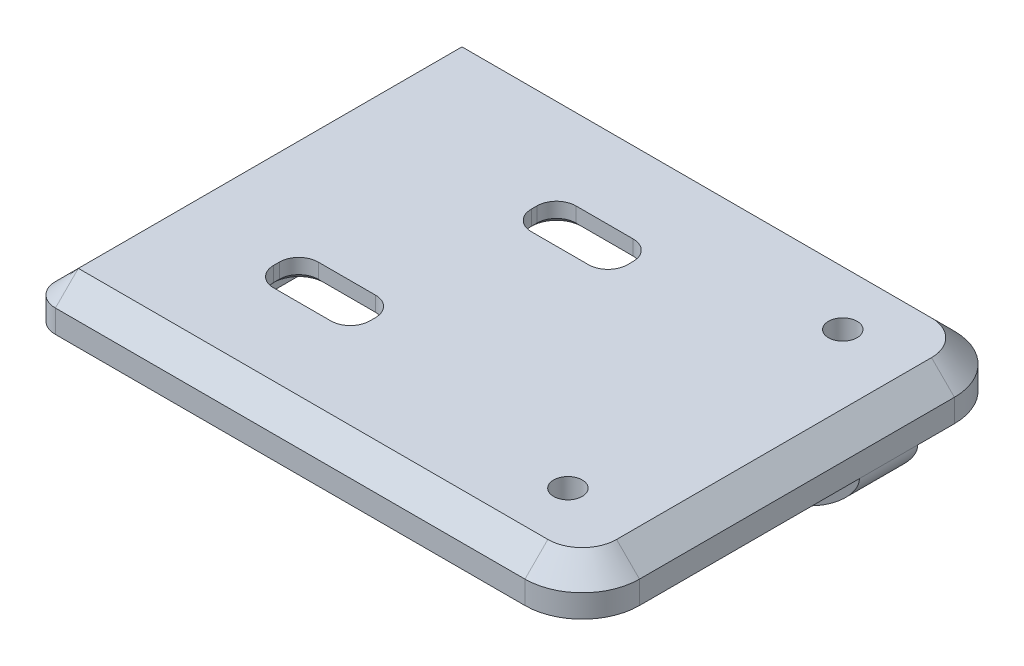
from build123d import *

# Parameters (mm, degrees)
BOSS_EXTRUDE1_START     = -0.8
BOSS_EXTRUDE1_OUTLINE_W = 48
BOSS_EXTRUDE1_OUTLINE_H = 37.5
BOSS_EXTRUDE1_DEPTH     = 0.8
BOSS_EXTRUDE2_DEPTH     = 4
SKETCH6_R               = 1.25
CUT_EXTRUDE3_DEPTH      = 36.602843988
BOSS_EXTRUDE3_DEPTH     = 2
SKETCH8_W               = 1.2
SKETCH8_H               = 13
BOSS_EXTRUDE4_DEPTH     = 6
SKETCH9_W               = 13
SKETCH9_H               = 0.8
BOSS_EXTRUDE5_DEPTH     = 1
FILLET3_R               = 5
FILLET2_R               = 1
FILLET6_R               = 2
CHAMFER1_SIZE           = 2
FILLET5_R               = 2
BOSS_EXTRUDE6_START     = 2
SKETCH11_R              = 3.1
SKETCH11_R_2            = 1.25
BOSS_EXTRUDE6_DEPTH     = 2
CHAMFER3_SIZE           = 0.4
CHAMFER4_SIZE           = 1
BOSS_EXTRUDE7_START     = 1
BOSS_EXTRUDE7_DEPTH     = 1
CHAMFER5_SIZE           = 1
CHAMFER6_SIZE           = 0.5
FILLET7_R               = 2


# Read off the part's stored shape, not the designer's step: Boss-Extrude1
# Some blends are built 0.0001 mm under size
with BuildPart() as part:
    # Boss-Extrude1 outline → Boss-Extrude1 (new body)
    with BuildSketch(Plane(origin=(0, 0, 0), x_dir=(1, 0, 0), z_dir=(0, 1, 0)).offset(BOSS_EXTRUDE1_START)):
        with Locations((6, 0)):
            Rectangle(BOSS_EXTRUDE1_OUTLINE_W, BOSS_EXTRUDE1_OUTLINE_H)
    extrude(amount=BOSS_EXTRUDE1_DEPTH)

    # Sketch3 → Boss-Extrude2 (add)
    with BuildSketch(Plane(origin=(0, 0, 0), x_dir=(1, 0, 0), z_dir=(0, 1, 0))):
        Polygon((-18, 18.75), (17, 18.75), (30, 18.75), (30, -18.75), (-18, -18.75), align=None)
        Polygon((-15.25, -16.75), (15.25, -16.75), (15.25, -10.876016447), (19.25, -6.645247216), (19.25, -0.095137399), (15.25, -4.32590663), (15.25, 16.75), (-15.25, 16.75), align=None, mode=Mode.SUBTRACT)
    extrude(amount=-BOSS_EXTRUDE2_DEPTH)

    # Sketch6 → Cut-Extrude3 (cut, through all)
    with BuildSketch(Plane(origin=(0, -4, 0), x_dir=(-1, 0, 0), z_dir=(0, -1, 0))):
        with Locations(Location((-22, 12, 0), (0, 0, 90))):
            Circle(SKETCH6_R)
        with Locations(Location((-22, -12, 0), (0, 0, 90))):
            Circle(SKETCH6_R)
        with BuildLine():
            Line((0.7, 7.5), (0.7, 8))
            ThreePointArc((0.7, 8), (0.202081528, 9.202081528), (-1, 9.7))
            Line((-1, 9.7), (-6, 9.7))
            ThreePointArc((-6, 9.7), (-7.202081528, 9.202081528), (-7.7, 8))
            Line((-7.7, 8), (-7.7, 7.5))
            ThreePointArc((-7.7, 7.5), (-7.202081528, 6.297918472), (-6, 5.8))
            Line((-6, 5.8), (-1, 5.8))
            ThreePointArc((-1, 5.8), (0.202081528, 6.297918472), (0.7, 7.5))
        make_face()
        with BuildLine():
            Line((1, -9.7), (6, -9.7))
            ThreePointArc((6, -9.7), (7.202081528, -9.202081528), (7.7, -8))
            Line((7.7, -8), (7.7, -7.5))
            ThreePointArc((7.7, -7.5), (7.202081528, -6.297918472), (6, -5.8))
            Line((6, -5.8), (1, -5.8))
            ThreePointArc((1, -5.8), (-0.202081528, -6.297918472), (-0.7, -7.5))
            Line((-0.7, -7.5), (-0.7, -8))
            ThreePointArc((-0.7, -8), (-0.202081528, -9.202081528), (1, -9.7))
        make_face()
    extrude(amount=-CUT_EXTRUDE3_DEPTH, mode=Mode.SUBTRACT)

    # Sketch7 → Boss-Extrude3 (add)
    with BuildSketch(Plane.XZ.offset(4)):
        Polygon((19.25, 5.917457236), (30, -5.452735071), (30, -10.547264929), (19.25, 0.822927379), align=None)
    extrude(amount=BOSS_EXTRUDE3_DEPTH)

    # Sketch8 → Boss-Extrude4 (add)
    with BuildSketch(Plane.XZ.offset(4)):
        with Locations((-17.4, 0)):
            Rectangle(SKETCH8_W, SKETCH8_H)
    extrude(amount=BOSS_EXTRUDE4_DEPTH)

    # Sketch9 → Boss-Extrude5 (add)
    with BuildSketch(Plane(origin=(-16.8, 0, 0), x_dir=(0, 0, -1), z_dir=(1, 0, 0))):
        with Locations((0, -9.6)):
            Rectangle(SKETCH9_W, SKETCH9_H)
    extrude(amount=BOSS_EXTRUDE5_DEPTH)

    # Fillet3
    fillet3_edges = [part.edges().sort_by_distance(p)[0] for p in [
        (30, -2, -18.75),
        (30, -2, 18.75),
        (15.25, -2.4, -16.75),
        (-15.25, -2.4, -16.75),
        (15.25, -2.4, 16.75),
        (-15.25, -2.4, 16.75),
        (-17.4, -4, 6.5),
        (-17.4, -4, -6.5),
    ]]
    fillet(fillet3_edges, radius=FILLET3_R)

    # Fillet2
    fillet2_edges = [part.edges().sort_by_distance(p)[0] for p in [
        (-16.8, -4, 0),
    ]]
    fillet(fillet2_edges, radius=FILLET2_R)

    # Fillet6
    fillet6_edges = [part.edges().sort_by_distance(p)[0] for p in [
        (15.25, -2.4, 4.32590663),
        (15.25, -2.4, 10.876016447),
        (-18, -2, -18.75),
        (-18, -2, 18.75),
    ]]
    fillet(fillet6_edges, radius=FILLET6_R)

    # Chamfer1
    # the kernel refuses this chamfer: 2 mm, written as the material it adds along each edge
    with BuildSketch(Plane(origin=(10.25, -0.8, -16.75), x_dir=(0, -0.9996219169112968, -0.027495876610585633), z_dir=(-1, 0, 0)), Plane(origin=(-10.25, -0.8, 16.75), x_dir=(0, -0.9996219169112968, 0.027495876610585633), z_dir=(1, 0, 0))) as chamfer1_piece_1:
        with BuildLine():
            Line((2.05734639, 0), (-0.11309431, 2.054235587))
            Line((-0.11309431, 2.054235587), (-0.153079186, 2.053135752))
            ThreePointArc((-0.153079186, 2.053135752), (-0.068258454, 1.026795659), (-0.039984877, -0.001099835))
            Line((-0.039984877, -0.001099835), (0.001099835, -0.039984877))
            ThreePointArc((0.001099835, -0.039984877), (1.028995329, -0.011711299), (2.058446225, -0.039984877))
            Line((2.058446225, -0.039984877), (2.05734639, 0))
        make_face()
    extrude(amount=20.5)
    with BuildSketch(Plane(origin=(15.25, -0.8, 11.75), x_dir=(0.027495876610586497, -0.9996219169112968, 0), z_dir=(0, 0, -1))) as chamfer1_piece_2:
        with BuildLine():
            Line((2.05734639, 0), (-0.11309431, 2.054235587))
            Line((-0.11309431, 2.054235587), (-0.153079186, 2.053135752))
            ThreePointArc((-0.153079186, 2.053135752), (-0.068258454, 1.026795659), (-0.039984877, -0.001099835))
            Line((-0.039984877, -0.001099835), (0.001099835, -0.039984877))
            ThreePointArc((0.001099835, -0.039984877), (1.028995329, -0.011711299), (2.058446225, -0.039984877))
            Line((2.058446225, -0.039984877), (2.05734639, 0))
        make_face()
    extrude(amount=0.07820825)
    with BuildSketch(Plane(origin=(-15.25, -0.8, -11.75), x_dir=(-0.02749587661058736, -0.9996219169112968, 0), z_dir=(0, 0, 1))) as chamfer1_piece_3:
        with BuildLine():
            Line((2.05734639, 0), (-0.11309431, 2.054235587))
            Line((-0.11309431, 2.054235587), (-0.153079186, 2.053135752))
            ThreePointArc((-0.153079186, 2.053135752), (-0.068258454, 1.026795659), (-0.039984877, -0.001099835))
            Line((-0.039984877, -0.001099835), (0.001099835, -0.039984877))
            ThreePointArc((0.001099835, -0.039984877), (1.028995329, -0.011711299), (2.058446225, -0.039984877))
            Line((2.058446225, -0.039984877), (2.05734639, 0))
        make_face()
    extrude(amount=23.5)
    with BuildSketch(Plane(origin=(-10.25, -0.8, 11.75), x_dir=(-1, 0, 0), z_dir=(0, 0, -1))) as chamfer1_piece_4:
        with BuildLine():
            Line((5.056568542, -2.056568542), (2.943431458, 0.056568542))
            Line((2.943431458, 0.056568542), (2.943431458, 0.096568542))
            ThreePointArc((2.943431458, 0.096568542), (3.971715729, 0.04), (5, 0.04))
            Line((5, 0.04), (5.04, 0))
            ThreePointArc((5.04, 0), (5.04, -1.028284271), (5.096568542, -2.056568542))
            Line((5.096568542, -2.056568542), (5.056568542, -2.056568542))
        make_face()
    revolve(axis=Axis((-10.25, -0.8, 11.75), (0, 1, 0)), revolution_arc=90)
    with BuildSketch(Plane(origin=(10.25, -0.8, 11.75), x_dir=(0, 0, 1), z_dir=(-1, 0, 0))) as chamfer1_piece_5:
        with BuildLine():
            Line((5.056568542, -2.056568542), (2.943431458, 0.056568542))
            Line((2.943431458, 0.056568542), (2.943431458, 0.096568542))
            ThreePointArc((2.943431458, 0.096568542), (3.971715729, 0.04), (5, 0.04))
            Line((5, 0.04), (5.04, 0))
            ThreePointArc((5.04, 0), (5.04, -1.028284271), (5.096568542, -2.056568542))
            Line((5.096568542, -2.056568542), (5.056568542, -2.056568542))
        make_face()
    revolve(axis=Axis((10.25, -0.8, 11.75), (0, 1, 0)), revolution_arc=90)
    with BuildSketch(Plane(origin=(-10.25, -0.8, -11.75), x_dir=(0, 0, -1), z_dir=(1, 0, 0))) as chamfer1_piece_6:
        with BuildLine():
            Line((5.056568542, -2.056568542), (2.943431458, 0.056568542))
            Line((2.943431458, 0.056568542), (2.943431458, 0.096568542))
            ThreePointArc((2.943431458, 0.096568542), (3.971715729, 0.04), (5, 0.04))
            Line((5, 0.04), (5.04, 0))
            ThreePointArc((5.04, 0), (5.04, -1.028284271), (5.096568542, -2.056568542))
            Line((5.096568542, -2.056568542), (5.056568542, -2.056568542))
        make_face()
    revolve(axis=Axis((-10.25, -0.8, -11.75), (0, 1, 0)), revolution_arc=90)
    with BuildSketch(Plane(origin=(10.25, -0.8, -11.75), x_dir=(1, 0, 0), z_dir=(0, 0, 1))) as chamfer1_piece_7:
        with BuildLine():
            Line((5.056568542, -2.056568542), (2.943431458, 0.056568542))
            Line((2.943431458, 0.056568542), (2.943431458, 0.096568542))
            ThreePointArc((2.943431458, 0.096568542), (3.971715729, 0.04), (5, 0.04))
            Line((5, 0.04), (5.04, 0))
            ThreePointArc((5.04, 0), (5.04, -1.028284271), (5.096568542, -2.056568542))
            Line((5.096568542, -2.056568542), (5.056568542, -2.056568542))
        make_face()
    revolve(axis=Axis((10.25, -0.8, -11.75), (0, 1, 0)), revolution_arc=90)
    with BuildSketch(Plane(origin=(15.796706691, -0.8, 10.297768985), x_dir=(0.01997978675069661, -0.9996219169112968, 0.018889980200658588), z_dir=(0.6870113824043602, 0, -0.7266466544661511))) as chamfer1_piece_8:
        with BuildLine():
            Line((2.05734639, 0), (-0.11309431, 2.054235587))
            Line((-0.11309431, 2.054235587), (-0.153079186, 2.053135752))
            ThreePointArc((-0.153079186, 2.053135752), (-0.068258454, 1.026795659), (-0.039984877, -0.001099835))
            Line((-0.039984877, -0.001099835), (0.001099835, -0.039984877))
            ThreePointArc((0.001099835, -0.039984877), (1.028995329, -0.011711299), (2.058446225, -0.039984877))
            Line((2.058446225, -0.039984877), (2.05734639, 0))
        make_face()
    extrude(amount=10.16991051)
    with BuildSketch(Plane(origin=(22.783550969, -0.8, -3.64227228), x_dir=(-0.019979786750696504, -0.9996219169112968, -0.018889980200658484), z_dir=(-0.6870113824043601, 0, 0.7266466544661513))) as chamfer1_piece_9:
        with BuildLine():
            Line((2.05734639, 0), (-0.11309431, 2.054235587))
            Line((-0.11309431, 2.054235587), (-0.153079186, 2.053135752))
            ThreePointArc((-0.153079186, 2.053135752), (-0.068258454, 1.026795659), (-0.039984877, -0.001099835))
            Line((-0.039984877, -0.001099835), (0.001099835, -0.039984877))
            ThreePointArc((0.001099835, -0.039984877), (1.028995329, -0.011711299), (2.058446225, -0.039984877))
            Line((2.058446225, -0.039984877), (2.05734639, 0))
        make_face()
    extrude(amount=5.939141279)
    with BuildSketch(Plane(origin=(15.25, -0.8, -0.700637904), x_dir=(0.027495876610585623, -0.9996219169112968, 0), z_dir=(0, 0, -1))) as chamfer1_piece_10:
        with BuildLine():
            Line((2.05734639, 0), (-0.11309431, 2.054235587))
            Line((-0.11309431, 2.054235587), (-0.153079186, 2.053135752))
            ThreePointArc((-0.153079186, 2.053135752), (-0.068258454, 1.026795659), (-0.039984877, -0.001099835))
            Line((-0.039984877, -0.001099835), (0.001099835, -0.039984877))
            ThreePointArc((0.001099835, -0.039984877), (1.028995329, -0.011711299), (2.058446225, -0.039984877))
            Line((2.058446225, -0.039984877), (2.05734639, 0))
        make_face()
    extrude(amount=11.049362096)
    with BuildSketch(Plane(origin=(17.25, -0.8, 11.67179175), x_dir=(-0.7266466544661513, 0, -0.6870113824043599), z_dir=(0.6870113824043599, 0, -0.7266466544661513))) as chamfer1_piece_11:
        with BuildLine():
            Line((1.943431458, -2.056568542), (4.056568542, 0.056568542))
            Line((4.056568542, 0.056568542), (4.056568542, 0.096568542))
            ThreePointArc((4.056568542, 0.096568542), (3.028284271, 0.04), (2, 0.04))
            Line((2, 0.04), (1.96, 0))
            ThreePointArc((1.96, 0), (1.96, -1.028284271), (1.903431458, -2.056568542))
            Line((1.903431458, -2.056568542), (1.943431458, -2.056568542))
        make_face()
    revolve(axis=Axis((17.25, -0.8, 11.67179175), (0, 1, 0)), revolution_arc=43.393997011)
    with BuildSketch(Plane(origin=(17.25, -0.8, -0.700637904), x_dir=(-1, 0, 0), z_dir=(0, 0, -1))) as chamfer1_piece_12:
        with BuildLine():
            Line((1.943431458, -2.056568542), (4.056568542, 0.056568542))
            Line((4.056568542, 0.056568542), (4.056568542, 0.096568542))
            ThreePointArc((4.056568542, 0.096568542), (3.028284271, 0.04), (2, 0.04))
            Line((2, 0.04), (1.96, 0))
            ThreePointArc((1.96, 0), (1.96, -1.028284271), (1.903431458, -2.056568542))
            Line((1.903431458, -2.056568542), (1.943431458, -2.056568542))
        make_face()
    revolve(axis=Axis((17.25, -0.8, -0.700637904), (0, 1, 0)), revolution_arc=136.606002989)
    chamfer1_2_edges = [part.edges().sort_by_distance(p)[0] for p in [
        (30, 0, 0),
        (4.5, 0, -18.75),
        (28.535533906, 0, 17.285533906),
        (28.535533906, 0, -17.285533906),
        (-18, 0, 0),
        (4.5, 0, 18.75),
        (-17.414213562, 0, -18.164213562),
        (-17.414213562, 0, 18.164213562),
    ]]
    chamfer(chamfer1_2_edges, length=CHAMFER1_SIZE)

    # Fillet5
    fillet5_edges = [part.edges().sort_by_distance(p)[0] for p in [
        (19.25, -0.8, 3.248775504),
    ]]
    fillet(fillet5_edges, radius=FILLET5_R)

    # Sketch11 → Boss-Extrude6 (add)
    # profile 1 of 2: a face of its own
    with BuildSketch(Plane.XZ.offset(4).offset(BOSS_EXTRUDE6_START)):
        with Locations(Location((22, -12, 0), (0, 0, 90))):
            Circle(SKETCH11_R)
        with Locations(Location((22, -12, 0), (0, 0, 270))):
            Circle(SKETCH11_R_2, mode=Mode.SUBTRACT)
    # profile 2 of 2: a face of its own
    with BuildSketch(Plane.XZ.offset(4).offset(BOSS_EXTRUDE6_START)):
        with Locations(Location((22, 12, 0), (0, 0, 90))):
            Circle(SKETCH11_R)
        with Locations(Location((22, 12, 0), (0, 0, 270))):
            Circle(SKETCH11_R_2, mode=Mode.SUBTRACT)
    extrude(amount=-BOSS_EXTRUDE6_DEPTH)

    # Chamfer3
    chamfer3_edges = [part.edges().sort_by_distance(p)[0] for p in [
        (22, -4, -15.1),
        (22, -6, -15.1),
        (22, -4, 8.9),
        (22, -6, 8.9),
    ]]
    chamfer(chamfer3_edges, length=CHAMFER3_SIZE)

    # Chamfer4
    chamfer4_edges = [part.edges().sort_by_distance(p)[0] for p in [
        (22, -6, -10.75),
        (22, -6, 13.25),
    ]]
    chamfer(chamfer4_edges, length=CHAMFER4_SIZE)

    # Sketch12 → Boss-Extrude7 (add)
    with BuildSketch(Plane.XZ.offset(0.8).offset(BOSS_EXTRUDE7_START)):
        with BuildLine():
            Line((-1, 11.7), (-6, 11.7))
            ThreePointArc((-6, 11.7), (-8.61629509, 10.61629509), (-9.7, 8))
            Line((-9.7, 8), (-9.7, 7.5))
            ThreePointArc((-9.7, 7.5), (-9.617088851, 6.72111089), (-9.372071219, 5.977129127))
            Line((-9.372071219, 5.977129127), (-2.372071219, -9.522870873))
            ThreePointArc((-2.372071219, -9.522870873), (-1.006910283, -11.108425826), (1, -11.7))
            Line((1, -11.7), (6, -11.7))
            ThreePointArc((6, -11.7), (8.61629509, -10.61629509), (9.7, -8))
            Line((9.7, -8), (9.7, -7.5))
            ThreePointArc((9.7, -7.5), (9.617088851, -6.72111089), (9.372071219, -5.977129127))
            Line((9.372071219, -5.977129127), (2.372071219, 9.522870873))
            ThreePointArc((2.372071219, 9.522870873), (1.006910283, 11.108425826), (-1, 11.7))
        make_face()
        with BuildLine():
            Line((-6, 5.8), (-1, 5.8))
            ThreePointArc((-1, 5.8), (0.202081528, 6.297918472), (0.7, 7.5))
            Line((0.7, 7.5), (0.7, 8))
            ThreePointArc((0.7, 8), (0.202081528, 9.202081528), (-1, 9.7))
            Line((-1, 9.7), (-6, 9.7))
            ThreePointArc((-6, 9.7), (-7.202081528, 9.202081528), (-7.7, 8))
            Line((-7.7, 8), (-7.7, 7.5))
            ThreePointArc((-7.7, 7.5), (-7.202081528, 6.297918472), (-6, 5.8))
        make_face(mode=Mode.SUBTRACT)
        with BuildLine():
            Line((6, -5.8), (1, -5.8))
            ThreePointArc((1, -5.8), (-0.202081528, -6.297918472), (-0.7, -7.5))
            Line((-0.7, -7.5), (-0.7, -8))
            ThreePointArc((-0.7, -8), (-0.202081528, -9.202081528), (1, -9.7))
            Line((1, -9.7), (6, -9.7))
            ThreePointArc((6, -9.7), (7.202081528, -9.202081528), (7.7, -8))
            Line((7.7, -8), (7.7, -7.5))
            ThreePointArc((7.7, -7.5), (7.202081528, -6.297918472), (6, -5.8))
        make_face(mode=Mode.SUBTRACT)
    extrude(amount=-BOSS_EXTRUDE7_DEPTH)

    # Chamfer5
    chamfer5_edges = [part.edges().sort_by_distance(p)[0] for p in [
        (-5.872071219, -1.8, -1.772870873),
        (-1.006910283, -1.8, -11.108425826),
        (-9.617088851, -1.8, 6.72111089),
        (3.5, -1.8, -11.7),
        (-9.7, -1.8, 7.75),
        (8.61629509, -1.8, -10.61629509),
        (-8.61629509, -1.8, 10.61629509),
        (9.7, -1.8, -7.75),
        (-3.5, -1.8, 11.7),
        (9.617088851, -1.8, -6.72111089),
        (1.006910283, -1.8, 11.108425826),
        (5.872071219, -1.8, 1.772870873),
    ]]
    chamfer(chamfer5_edges, length=CHAMFER5_SIZE - 0.0001)  # a hair under: the kernel refuses the full size

    # Chamfer6
    chamfer6_edges = [part.edges().sort_by_distance(p)[0] for p in [
        (-7.202081528, -1.8, 6.297918472),
        (-3.5, -1.8, 5.8),
        (0.202081528, -1.8, 6.297918472),
        (0.7, -1.8, 7.75),
        (0.202081528, -1.8, 9.202081528),
        (-3.5, -1.8, 9.7),
        (-7.202081528, -1.8, 9.202081528),
        (-7.7, -1.8, 7.75),
        (7.202081528, -1.8, -6.297918472),
        (3.5, -1.8, -5.8),
        (-0.202081528, -1.8, -6.297918472),
        (-0.7, -1.8, -7.75),
        (-0.202081528, -1.8, -9.202081528),
        (3.5, -1.8, -9.7),
        (7.202081528, -1.8, -9.202081528),
        (7.7, -1.8, -7.75),
    ]]
    chamfer(chamfer6_edges, length=CHAMFER6_SIZE)

    # Fillet7
    fillet7_edges = [part.edges().sort_by_distance(p)[0] for p in [
        (30, -6, -8),
        (19.25, -6, 3.370192308),
    ]]
    fillet(fillet7_edges, radius=FILLET7_R)


solid = part.part
